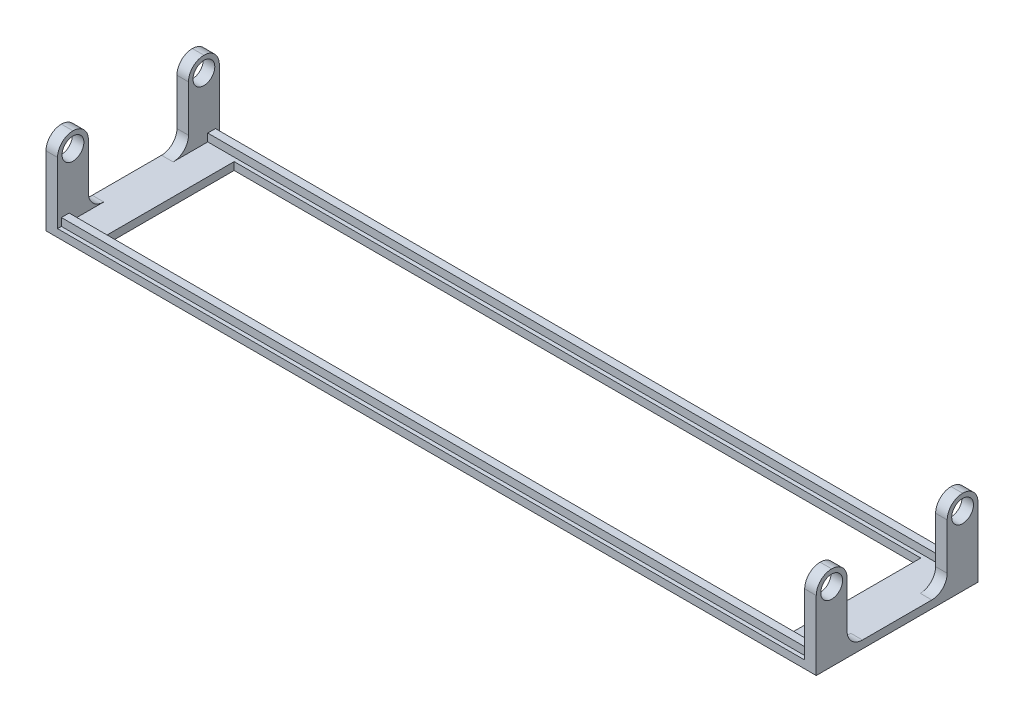
from build123d import *

# Parameters (mm, degrees)
SKETCH1_W               = 2000
SKETCH1_H               = 420
SKETCH1_W_2             = 1782.939992392
SKETCH1_H_2             = 340
BOSS_EXTRUDE1_DEPTH     = 20
SKETCH3_W               = 30
SKETCH3_H               = 80
BOSS_EXTRUDE2_DEPTH     = 200
FILLET1_R               = 40
FILLET2_R               = 40
SKETCH5_W               = 972.378142936
SKETCH5_H               = 20.021799472
SKETCH5_W_2             = 1944.756285872
BOSS_EXTRUDE5_DEPTH     = 20
CUT_EXTRUDE3_DEPTH      = 2088
CUT_EXTRUDE3_DEPTH_BACK = 85
SKETCH9_R               = 28.284271247


with BuildPart() as part:
    # Sketch1 → Boss-Extrude1 (new body)
    with BuildSketch(Plane(origin=(0, 0, 0), x_dir=(1, 0, 0), z_dir=(0, 1, 0))):
        Rectangle(SKETCH1_W, SKETCH1_H)
        Rectangle(SKETCH1_W_2, SKETCH1_H_2, mode=Mode.SUBTRACT)
    extrude(amount=BOSS_EXTRUDE1_DEPTH)

    # Sketch3 → Boss-Extrude2 (add)
    with BuildSketch(Plane(origin=(0, 20, 0), x_dir=(1, 0, 0), z_dir=(0, 1, 0))):
        with Locations((-985, 170)):
            Rectangle(SKETCH3_W, SKETCH3_H)
        with Locations((985, -170)):
            Rectangle(SKETCH3_W, SKETCH3_H)
        with Locations((985, 170)):
            Rectangle(SKETCH3_W, SKETCH3_H)
        with Locations((-985, -170)):
            Rectangle(SKETCH3_W, SKETCH3_H)
    extrude(amount=BOSS_EXTRUDE2_DEPTH)

    # Fillet1
    fillet1_edges = [part.edges().sort_by_distance(p)[0] for p in [
        (-985, 220, -210),
        (-985, 220, -130),
        (-985, 220, 130),
        (-985, 220, 210),
        (985, 220, -210),
        (985, 220, -130),
        (985, 220, 130),
        (985, 220, 210),
    ]]
    fillet(fillet1_edges, radius=FILLET1_R - 0.0001)  # a hair under: the kernel refuses the full size

    # Fillet2
    fillet2_edges = [part.edges().sort_by_distance(p)[0] for p in [
        (985, 20, 130),
        (985, 20, -130),
        (-985, 20, -130),
        (-985, 20, 130),
    ]]
    fillet(fillet2_edges, radius=FILLET2_R)

    # Sketch5 → Boss-Extrude5 (add)
    with BuildSketch(Plane(origin=(0, 20, 0), x_dir=(1, 0, 0), z_dir=(0, 1, 0))):
        with Locations((486.189071468, -190)):
            Rectangle(SKETCH5_W, SKETCH5_H)
        with Locations((0, 190)):
            Rectangle(SKETCH5_W_2, SKETCH5_H)
        with Locations((-486.189071468, -190)):
            Rectangle(SKETCH5_W, SKETCH5_H)
    extrude(amount=BOSS_EXTRUDE5_DEPTH)

    # Sketch9 → Cut-Extrude3 (cut, two sides: drawn at the far end of the back side and taken through both)
    with BuildSketch(Plane.ZY.offset(-970).offset(-CUT_EXTRUDE3_DEPTH_BACK)):
        with Locations(Location((-170, 180, 0), (0, 0, 180))):
            Circle(SKETCH9_R)
        with Locations(Location((170, 180, 0), (0, 0, 180))):
            Circle(SKETCH9_R)
    extrude(amount=CUT_EXTRUDE3_DEPTH + CUT_EXTRUDE3_DEPTH_BACK, mode=Mode.SUBTRACT)


solid = part.part
